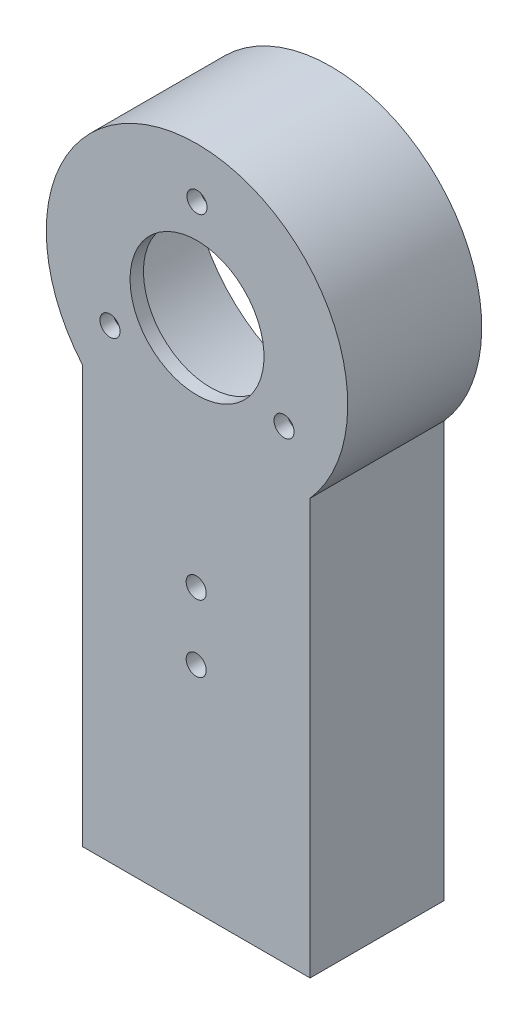
from build123d import *

# Parameters (mm, degrees)
SKETCH1_R           = 1.5
BOSS_EXTRUDE1_DEPTH = 20
SKETCH2_R           = 10
CUT_EXTRUDE1_DEPTH  = 20
SKETCH3_R           = 1.5
CUT_EXTRUDE2_DEPTH  = 20
SKETCH4_R           = 21
CUT_EXTRUDE3_DEPTH  = 18


with BuildPart() as part:
    # Sketch1 → Boss-Extrude1 (new body)
    with BuildSketch(Plane.XY):
        with BuildLine():
            Line((16.876374486, -76.9), (16.876374486, -14.880792459))
            ThreePointArc((16.876374486, -14.880792459), (0.188725707, 22.499208488), (-17.123625514, -14.595596913))
            Line((-17.123625514, -14.595596913), (-17.123625514, -76.9))
            Line((-17.123625514, -76.9), (16.876374486, -76.9))
        make_face()
        with Locations((-0.123625514, -44.9)):
            Circle(SKETCH1_R, mode=Mode.SUBTRACT)
        with Locations((-0.123625514, -34.9)):
            Circle(SKETCH1_R, mode=Mode.SUBTRACT)
    extrude(amount=BOSS_EXTRUDE1_DEPTH)

    # Sketch2 → Cut-Extrude1 (cut)
    with BuildSketch(Plane(origin=(0, 0, 0), x_dir=(-1, 0, 0), z_dir=(0, 0, -1))):
        Circle(SKETCH2_R)
    extrude(amount=-CUT_EXTRUDE1_DEPTH, mode=Mode.SUBTRACT)

    # Sketch3 → Cut-Extrude2 (cut)
    with BuildSketch(Plane(origin=(0, 0, 0), x_dir=(-1, 0, 0), z_dir=(0, 0, -1))):
        with Locations((0, 15)):
            Circle(SKETCH3_R)
        with Locations((12.990381057, -7.5)):
            Circle(SKETCH3_R)
        with Locations((-12.990381057, -7.5)):
            Circle(SKETCH3_R)
    extrude(amount=-CUT_EXTRUDE2_DEPTH, mode=Mode.SUBTRACT)

    # Sketch4 → Cut-Extrude3 (cut)
    with BuildSketch(Plane(origin=(0, 0, 0), x_dir=(-1, 0, 0), z_dir=(0, 0, -1))):
        Circle(SKETCH4_R)
    extrude(amount=-CUT_EXTRUDE3_DEPTH, mode=Mode.SUBTRACT)


solid = part.part
